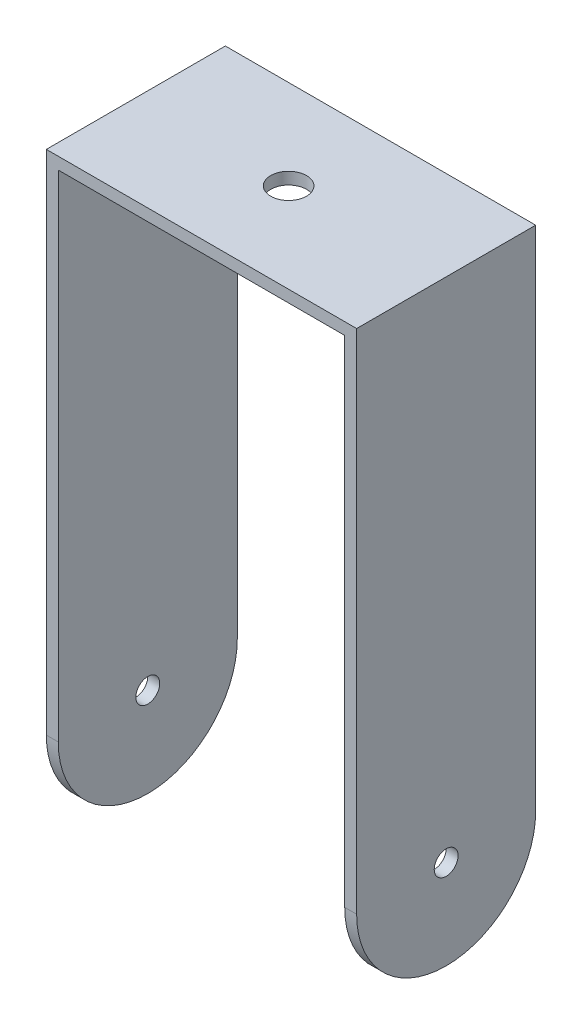
from build123d import *

# Parameters (mm, degrees)
BOSS_EXTRUDE1_DEPTH = 75
SKETCH2_R           = 7.5
CUT_EXTRUDE1_DEPTH  = 8
SKETCH3_R           = 5
CUT_EXTRUDE2_DEPTH  = 134
FILLET1_R           = 37.5


with BuildPart() as part:
    # Sketch1 → Boss-Extrude1 (new body)
    with BuildSketch(Plane.XY):
        Polygon((125, -250), (130, -250), (130, 0), (0, 0), (0, -250), (5, -250), (5, -5), (125, -5), align=None)
    extrude(amount=BOSS_EXTRUDE1_DEPTH)

    # Sketch2 → Cut-Extrude1 (cut)
    with BuildSketch(Plane(origin=(0, 0, 0), x_dir=(1, 0, 0), z_dir=(0, 1, 0))):
        with Locations(Location((64, -37.5, 0), (0, 0, 270))):
            Circle(SKETCH2_R)
    extrude(amount=-CUT_EXTRUDE1_DEPTH, mode=Mode.SUBTRACT)

    # Sketch3 → Cut-Extrude2 (cut)
    with BuildSketch(Plane(origin=(130, 0, 0), x_dir=(0, 0, -1), z_dir=(1, 0, 0))):
        with Locations(Location((-37.5, -212.5, 0), (0, 0, 90))):
            Circle(SKETCH3_R)
    extrude(amount=-CUT_EXTRUDE2_DEPTH, mode=Mode.SUBTRACT)

    # Fillet1
    fillet1_edges = [part.edges().sort_by_distance(p)[0] for p in [
        (127.5, -250, 75),
        (2.5, -250, 75),
        (2.5, -250, 0),
        (127.5, -250, 0),
    ]]
    fillet(fillet1_edges, radius=FILLET1_R - 0.0001)  # a hair under: the kernel refuses the full size


solid = part.part
